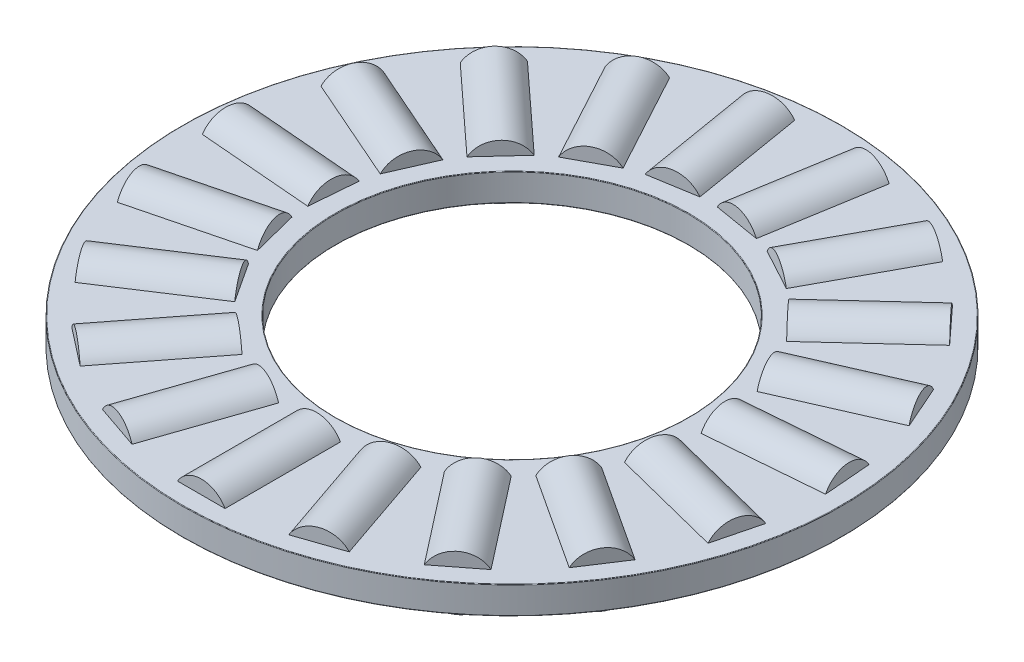
from build123d import *

# Parameters (mm, degrees)
SKETCH1_W         = 5.53085
SKETCH1_H         = 0.9921875
SKETCH3_W         = 4.1671875
SKETCH3_H         = 0.9921875
SKETCH2_W         = 4.1671875
SKETCH2_H         = 0.9921875
CIRPATTERN1_COUNT = 19
CIRPATTERN1_ANGLE = 341.052631579
CIRPATTERN2_COUNT = 19
FILLET2_R         = 0.01984375


with BuildPart() as part:
    # Sketch1 → Revolve1 (revolve)
    with BuildSketch(Plane(origin=(0, 0, 0), x_dir=(0, 0, -1), z_dir=(1, 0, 0))):
        with Locations((-9.140825, 0)):
            Rectangle(SKETCH1_W, SKETCH1_H)
    revolve(axis=Axis((0, -0.9921875, 0), (0, 1, 0)))

    # Sketch3 → Cut-Revolve1 (revolve, cut)
    with BuildSketch(Plane(origin=(0, 0, 0), x_dir=(0, 0, -1), z_dir=(1, 0, 0))):
        with Locations((-9.140825, 0.49609375)):
            Rectangle(SKETCH3_W, SKETCH3_H)
    cut_revolve1 = revolve(axis=Axis((0, 0, 11.22441875), (0, 0, -1)), mode=Mode.SUBTRACT)

    # CirPattern2: Cut-Revolve1 ×19 about axis
    cirpattern2_axis = Axis((0, 0.9921875, 0), (0, -1, 0))
    for i in range(1, CIRPATTERN2_COUNT):
        add(cut_revolve1.rotate(cirpattern2_axis, i * 360 / CIRPATTERN2_COUNT), mode=Mode.SUBTRACT)

    # Fillet2
    fillet2_edges = [part.edges().sort_by_distance(p)[0] for p in [
        (0, -0.49609375, -6.3754),
        (0, 0.49609375, -6.3754),
        (0, -0.49609375, -11.90625),
        (0, 0.49609375, -11.90625),
    ]]
    fillet(fillet2_edges, radius=FILLET2_R)


with BuildPart() as body_2:
    # Sketch2 → Revolve2 (revolve)
    with BuildSketch(Plane(origin=(0, 0, 0), x_dir=(0, 0, -1), z_dir=(1, 0, 0))):
        with Locations((-9.140825, 0.49609375)):
            Rectangle(SKETCH2_W, SKETCH2_H)
    revolve(axis=Axis((0, 0, 11.22441875), (0, 0, -1)))


with BuildPart() as cirpattern1_1:
    # CirPattern1: pattern copy
    add(body_2.part.rotate(Axis((0, 0.9921875, 0), (0, -1, 0)), 1 * CIRPATTERN1_ANGLE / (CIRPATTERN1_COUNT - 1)))


with BuildPart() as cirpattern1_2:
    # CirPattern1: pattern copy
    add(body_2.part.rotate(Axis((0, 0.9921875, 0), (0, -1, 0)), 2 * CIRPATTERN1_ANGLE / (CIRPATTERN1_COUNT - 1)))


with BuildPart() as cirpattern1_3:
    # CirPattern1: pattern copy
    add(body_2.part.rotate(Axis((0, 0.9921875, 0), (0, -1, 0)), 3 * CIRPATTERN1_ANGLE / (CIRPATTERN1_COUNT - 1)))


with BuildPart() as cirpattern1_4:
    # CirPattern1: pattern copy
    add(body_2.part.rotate(Axis((0, 0.9921875, 0), (0, -1, 0)), 4 * CIRPATTERN1_ANGLE / (CIRPATTERN1_COUNT - 1)))


with BuildPart() as cirpattern1_5:
    # CirPattern1: pattern copy
    add(body_2.part.rotate(Axis((0, 0.9921875, 0), (0, -1, 0)), 5 * CIRPATTERN1_ANGLE / (CIRPATTERN1_COUNT - 1)))


with BuildPart() as cirpattern1_6:
    # CirPattern1: pattern copy
    add(body_2.part.rotate(Axis((0, 0.9921875, 0), (0, -1, 0)), 6 * CIRPATTERN1_ANGLE / (CIRPATTERN1_COUNT - 1)))


with BuildPart() as cirpattern1_7:
    # CirPattern1: pattern copy
    add(body_2.part.rotate(Axis((0, 0.9921875, 0), (0, -1, 0)), 7 * CIRPATTERN1_ANGLE / (CIRPATTERN1_COUNT - 1)))


with BuildPart() as cirpattern1_8:
    # CirPattern1: pattern copy
    add(body_2.part.rotate(Axis((0, 0.9921875, 0), (0, -1, 0)), 8 * CIRPATTERN1_ANGLE / (CIRPATTERN1_COUNT - 1)))


with BuildPart() as cirpattern1_9:
    # CirPattern1: pattern copy
    add(body_2.part.rotate(Axis((0, 0.9921875, 0), (0, -1, 0)), 9 * CIRPATTERN1_ANGLE / (CIRPATTERN1_COUNT - 1)))


with BuildPart() as cirpattern1_10:
    # CirPattern1: pattern copy
    add(body_2.part.rotate(Axis((0, 0.9921875, 0), (0, -1, 0)), 10 * CIRPATTERN1_ANGLE / (CIRPATTERN1_COUNT - 1)))


with BuildPart() as cirpattern1_11:
    # CirPattern1: pattern copy
    add(body_2.part.rotate(Axis((0, 0.9921875, 0), (0, -1, 0)), 11 * CIRPATTERN1_ANGLE / (CIRPATTERN1_COUNT - 1)))


with BuildPart() as cirpattern1_12:
    # CirPattern1: pattern copy
    add(body_2.part.rotate(Axis((0, 0.9921875, 0), (0, -1, 0)), 12 * CIRPATTERN1_ANGLE / (CIRPATTERN1_COUNT - 1)))


with BuildPart() as cirpattern1_13:
    # CirPattern1: pattern copy
    add(body_2.part.rotate(Axis((0, 0.9921875, 0), (0, -1, 0)), 13 * CIRPATTERN1_ANGLE / (CIRPATTERN1_COUNT - 1)))


with BuildPart() as cirpattern1_14:
    # CirPattern1: pattern copy
    add(body_2.part.rotate(Axis((0, 0.9921875, 0), (0, -1, 0)), 14 * CIRPATTERN1_ANGLE / (CIRPATTERN1_COUNT - 1)))


with BuildPart() as cirpattern1_15:
    # CirPattern1: pattern copy
    add(body_2.part.rotate(Axis((0, 0.9921875, 0), (0, -1, 0)), 15 * CIRPATTERN1_ANGLE / (CIRPATTERN1_COUNT - 1)))


with BuildPart() as cirpattern1_16:
    # CirPattern1: pattern copy
    add(body_2.part.rotate(Axis((0, 0.9921875, 0), (0, -1, 0)), 16 * CIRPATTERN1_ANGLE / (CIRPATTERN1_COUNT - 1)))


with BuildPart() as cirpattern1_17:
    # CirPattern1: pattern copy
    add(body_2.part.rotate(Axis((0, 0.9921875, 0), (0, -1, 0)), 17 * CIRPATTERN1_ANGLE / (CIRPATTERN1_COUNT - 1)))


with BuildPart() as cirpattern1_18:
    # CirPattern1: pattern copy
    add(body_2.part.rotate(Axis((0, 0.9921875, 0), (0, -1, 0)), 18 * CIRPATTERN1_ANGLE / (CIRPATTERN1_COUNT - 1)))


solid = Compound([part.part, body_2.part, cirpattern1_1.part, cirpattern1_2.part, cirpattern1_3.part, cirpattern1_4.part, cirpattern1_5.part, cirpattern1_6.part, cirpattern1_7.part, cirpattern1_8.part, cirpattern1_9.part, cirpattern1_10.part, cirpattern1_11.part, cirpattern1_12.part, cirpattern1_13.part, cirpattern1_14.part, cirpattern1_15.part, cirpattern1_16.part, cirpattern1_17.part, cirpattern1_18.part])
